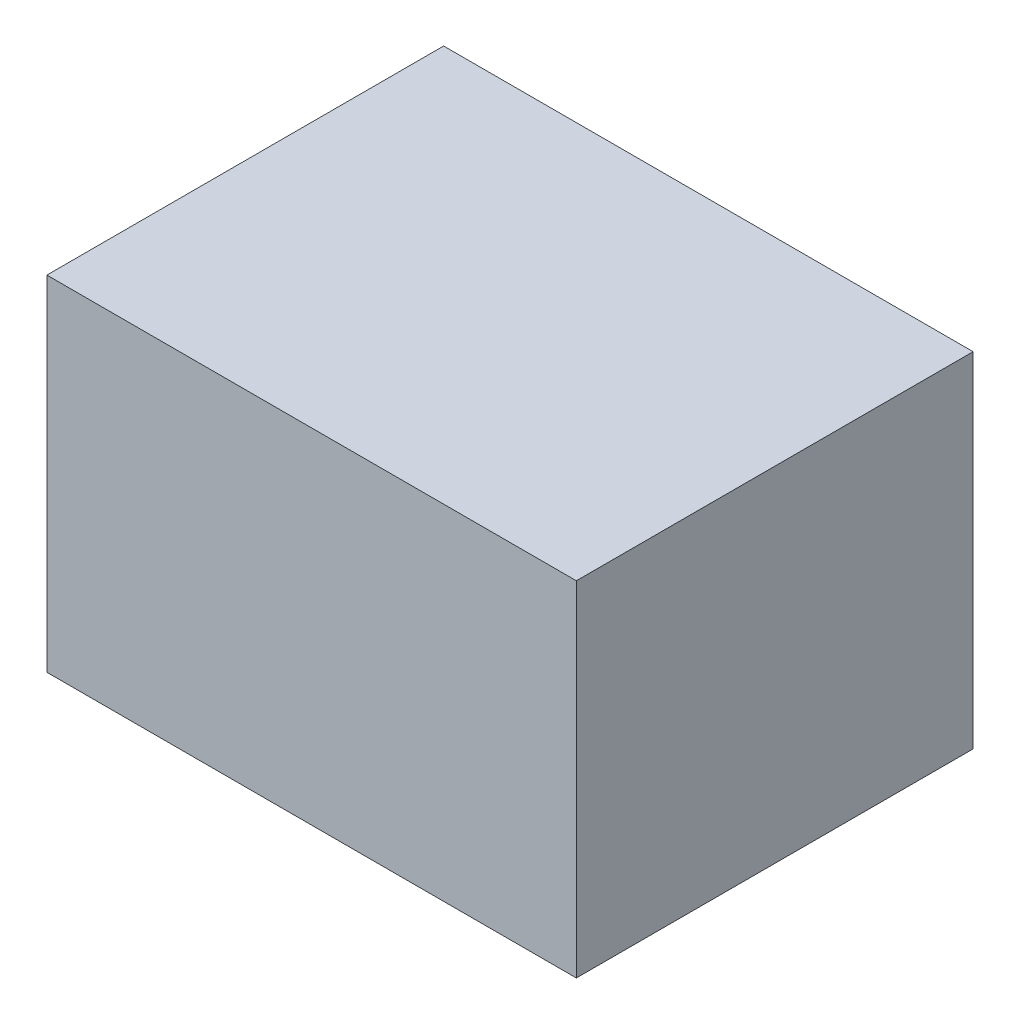
from build123d import *

# Parameters (mm, degrees)
SKETCH2_W           = 1576.130147445
SKETCH2_H           = 1024.07796368
BOSS_EXTRUDE1_DEPTH = 1181.1


with BuildPart() as part:
    # Sketch2 → Boss-Extrude1 (new body)
    with BuildSketch(Plane.XY):
        with Locations((774.034926278, 503.96101816)):
            Rectangle(SKETCH2_W, SKETCH2_H)
    extrude(amount=BOSS_EXTRUDE1_DEPTH)


with BuildPart() as part_1:
    # Body-Move/Copy1: moved
    add(part.part.moved(Location((-1570.589453565, 0, 0))))


solid = part_1.part
